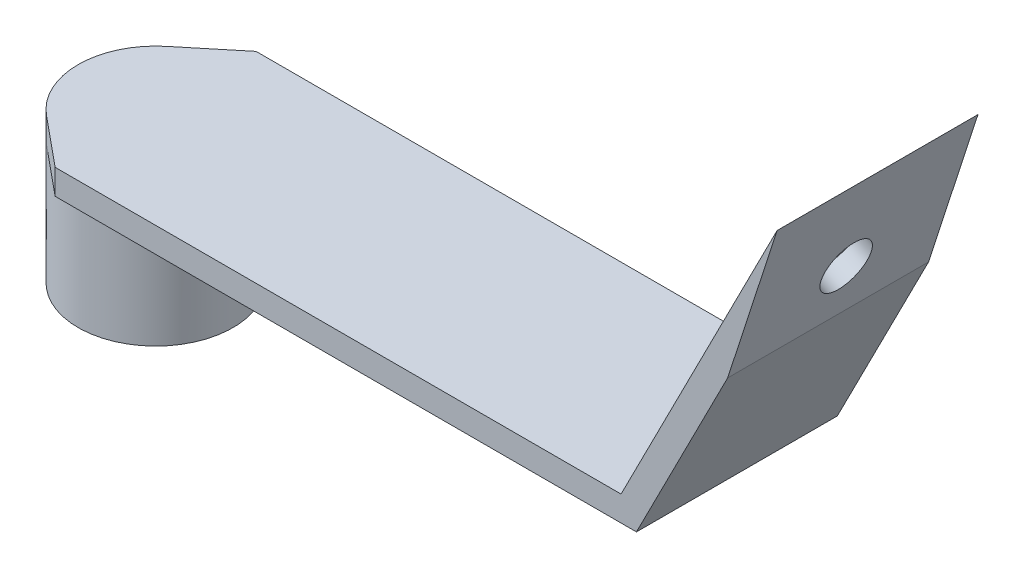
from build123d import *

# Parameters (mm, degrees)
BOSS_EXTRUDE1_DEPTH = 25.4
SKETCH2_R           = 9.801448676
SKETCH2_R_2         = 7.071368029
BOSS_EXTRUDE2_DEPTH = 19
BOSS_EXTRUDE3_DEPTH = 3.175
SKETCH4_R           = 3.175
CUT_EXTRUDE1_DEPTH  = 3.175


with BuildPart() as part:
    # Sketch1 → Boss-Extrude1 (new body)
    with BuildSketch(Plane.XY):
        Polygon((-92.495819173, -3.422180745), (-20.941461675, -3.422180745), (-1.20885062, 35.305249012), (-7.464460479, 16.03438497), (-18.995819173, -6.597180745), (-92.495819173, -6.597180745), align=None)
    extrude(amount=BOSS_EXTRUDE1_DEPTH)

    # Sketch2 → Boss-Extrude2 (add)
    with BuildSketch(Plane(origin=(0, -3.422180745, 0), x_dir=(1, 0, 0), z_dir=(0, 1, 0))):
        with Locations((-92.495819173, -12.7)):
            Circle(SKETCH2_R)
        with Locations((-92.495819173, -12.7)):
            Circle(SKETCH2_R_2, mode=Mode.SUBTRACT)
    extrude(amount=-BOSS_EXTRUDE2_DEPTH)

    # Sketch3 → Boss-Extrude3 (add)
    with BuildSketch(Plane(origin=(0, -3.422180745, 0), x_dir=(1, 0, 0), z_dir=(0, 1, 0))):
        Polygon((-92.495819173, 0), (-98.728601618, -5.135555597), (-102.297267848, -12.7), (-98.728601618, -20.264444403), (-92.495819173, -25.4), align=None)
    extrude(amount=-BOSS_EXTRUDE3_DEPTH)

    # Sketch4 → Cut-Extrude1 (cut)
    with BuildSketch(Plane(origin=(-15.240970814, 7.765662505, 0), x_dir=(0, 0, 1), z_dir=(-0.8910065241883692, 0.45399049973954403, 0))):
        with Locations((12.7, 18.20840051)):
            Circle(SKETCH4_R)
    extrude(amount=-CUT_EXTRUDE1_DEPTH, mode=Mode.SUBTRACT)


solid = part.part
